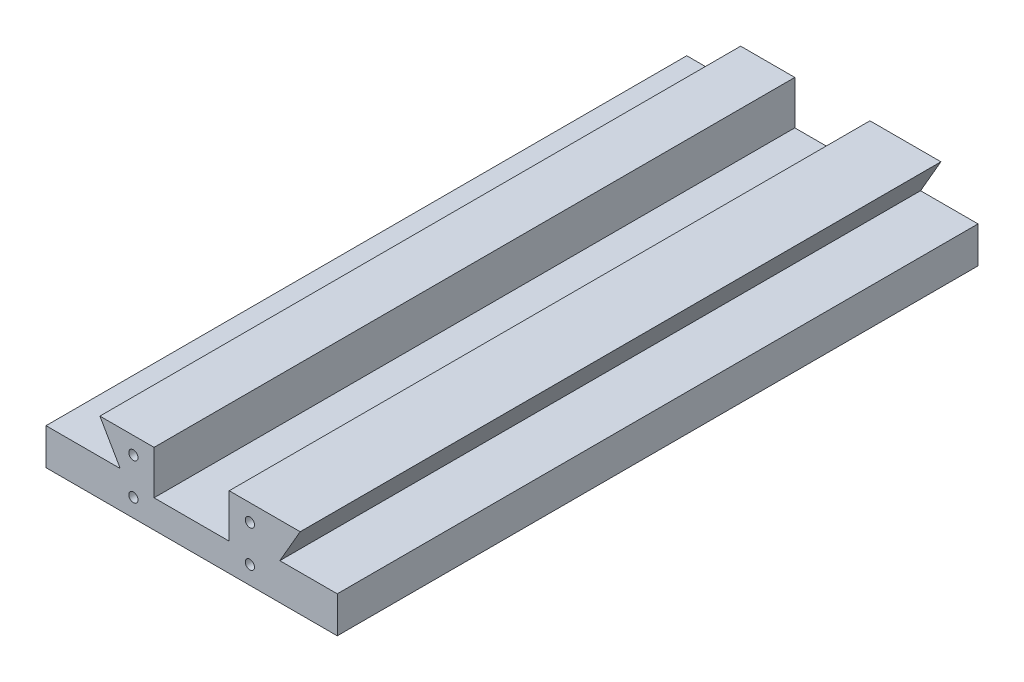
from build123d import *

# Parameters (mm, degrees)
X_GUIDE_EXTRUDE_DEPTH   = 279.4
END_PLATE_HOLES_D       = 4.0386
END_PLATE_HOLES_DEPTH   = 11.938
END_PLATE_HOLES_TIP     = 1.213317848
END_PLATE_HOLES_2_D     = 4.0386
END_PLATE_HOLES_2_DEPTH = 11.938
END_PLATE_HOLES_2_TIP   = 1.213317848


with BuildPart() as part:
    # dovetail-male-profile → x-guide-extrude (new body)
    with BuildSketch(Plane.XY):
        Polygon((38.459564477, 15.875), (47.331706063, 31.242), (16.383, 31.242), (16.383, 12.192), (-16.383, 12.192), (-16.383, 31.242), (-39.999357645, 31.242), (-31.127216058, 15.875), (-63.5, 15.875), (-63.5, 0), (63.5, 0), (63.5, 15.875), align=None)
    extrude(amount=X_GUIDE_EXTRUDE_DEPTH)

    # end plate holes
    with Locations(Plane(origin=(0, 0, 0), x_dir=(-1, 0, 0), z_dir=(0, 0, -1))):
        with Locations((-25.4, 23.8125), (25.4, 23.8125), (25.4, 7.874), (-25.4, 7.874)):
            Hole(END_PLATE_HOLES_D / 2, depth=END_PLATE_HOLES_DEPTH)
            with Locations((0, 0, -(END_PLATE_HOLES_DEPTH + END_PLATE_HOLES_TIP / 2))):  # 118° drill point
                Cone(0, END_PLATE_HOLES_D / 2, END_PLATE_HOLES_TIP, mode=Mode.SUBTRACT)

    # end plate holes 2
    with Locations(Plane.XY.offset(279.4)):
        with Locations((25.4, 23.8125), (25.4, 7.874), (-25.4, 7.874), (-25.4, 23.8125)):
            Hole(END_PLATE_HOLES_2_D / 2, depth=END_PLATE_HOLES_2_DEPTH)
            with Locations((0, 0, -(END_PLATE_HOLES_2_DEPTH + END_PLATE_HOLES_2_TIP / 2))):  # 118° drill point
                Cone(0, END_PLATE_HOLES_2_D / 2, END_PLATE_HOLES_2_TIP, mode=Mode.SUBTRACT)


solid = part.part
